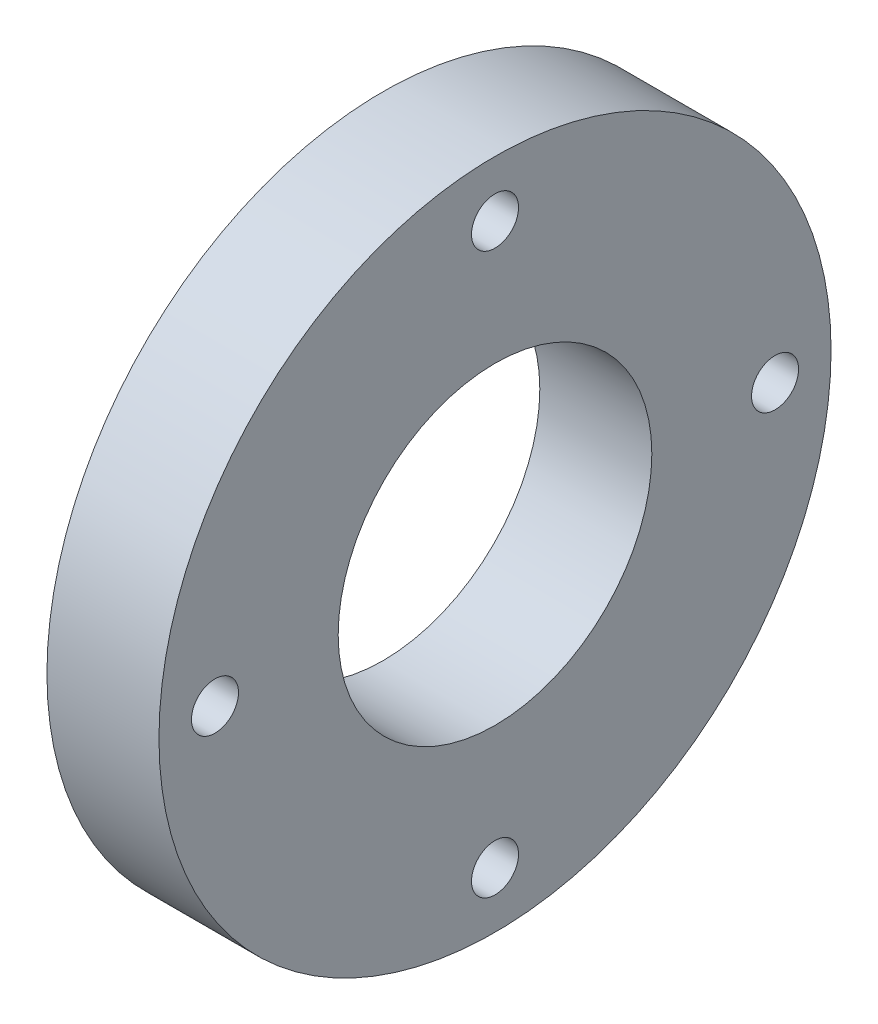
from build123d import *

# Parameters (mm, degrees)
SKETCH1_W                      = 5
SKETCH1_H                      = 15
F_14_0_14_DIAMETER_HOLE1_D     = 14
F_2_1_2_1_DIAMETER_HOLE1_D     = 2.1
F_2_1_2_1_DIAMETER_HOLE1_DEPTH = 2.5


with BuildPart() as part:
    # Sketch1 → Revolve1 (revolve)
    with BuildSketch(Plane.XY):
        with Locations((23.5, 7.5)):
            Rectangle(SKETCH1_W, SKETCH1_H)
    revolve(axis=Axis((21, 0, 0), (1, 0, 0)))

    # Ø14.0 (14) Diameter Hole1 (through all)
    with Locations(Plane.ZY.offset(-21)):
        with Locations((0, 0)):
            Hole(F_14_0_14_DIAMETER_HOLE1_D / 2)

    # Ø2.1 (2.1) Diameter Hole1
    with Locations(Plane(origin=(26, 0, 0), x_dir=(0, 0, -1), z_dir=(1, 0, 0))):
        with Locations((-12.5, 0), (12.5, 0), (0, -12.5), (0, 12.5)):
            Hole(F_2_1_2_1_DIAMETER_HOLE1_D / 2, depth=F_2_1_2_1_DIAMETER_HOLE1_DEPTH)


solid = part.part
